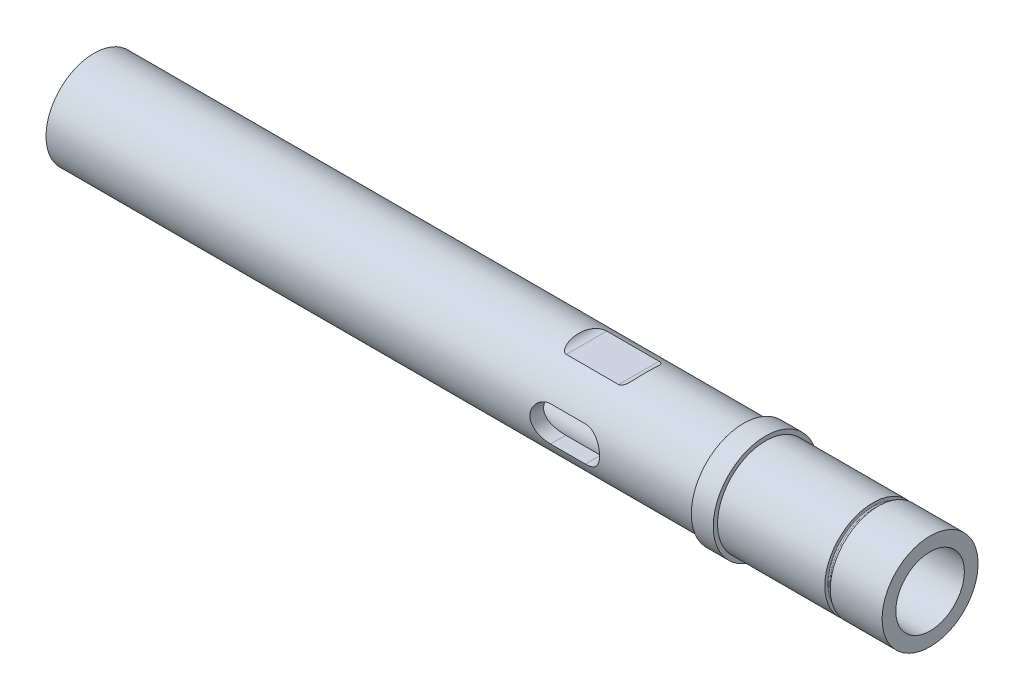
from build123d import *

# Parameters (mm, degrees)
SKETCH1_R               = 17.5
SKETCH1_R_2             = 12.5
BOSS_EXTRUDE1_DEPTH     = 152.4
SKETCH2_R               = 19.05
SKETCH2_R_2             = 17.5
BOSS_EXTRUDE2_DEPTH     = 8
SKETCH4_R               = 17.5
SKETCH4_R_2             = 16
CUT_EXTRUDE2_DEPTH      = 2
FILLET1_R               = 0.4064
CUT_EXTRUDE3_DEPTH      = 155.762931608
CUT_EXTRUDE3_DEPTH_BACK = 155.762931608
SKETCH8_W               = 25.4
SKETCH8_H               = 3.175
FILLET2_R               = 3.175
CUT_EXTRUDE4_REACH      = 156.763
CUT_EXTRUDE4_END_RADIUS = 17.5


with BuildPart() as part:
    # Sketch1 → Boss-Extrude1 (new, symmetric)
    with BuildSketch(Plane(origin=(0, 0, 0), x_dir=(0, 0, -1), z_dir=(1, 0, 0))):
        with Locations(Location((0, 0, 0), (0, 0, 180))):
            Circle(SKETCH1_R)
        with Locations(Location((0, 0, 0), (0, 0, 180))):
            Circle(SKETCH1_R_2, mode=Mode.SUBTRACT)
    extrude(amount=BOSS_EXTRUDE1_DEPTH, both=True)

    # Sketch2 → Boss-Extrude2 (add)
    with BuildSketch(Plane.ZY.offset(-92.4)):
        Circle(SKETCH2_R)
        Circle(SKETCH2_R_2, mode=Mode.SUBTRACT)
    extrude(amount=BOSS_EXTRUDE2_DEPTH)

    # Sketch4 → Cut-Extrude2 (cut)
    with BuildSketch(Plane(origin=(133.52, 0, 0), x_dir=(0, 0, -1), z_dir=(1, 0, 0))):
        with Locations(Location((0, 0, 0), (0, 0, 180))):
            Circle(SKETCH4_R)
        Circle(SKETCH4_R_2, mode=Mode.SUBTRACT)
    extrude(amount=-CUT_EXTRUDE2_DEPTH, mode=Mode.SUBTRACT)

    # Fillet1
    fillet1_edges = [part.edges().sort_by_distance(p)[0] for p in [
        (131.52, 0, 16),
        (133.52, 0, 16),
    ]]
    fillet(fillet1_edges, radius=FILLET1_R)

    # Sketch8 → Cut-Extrude3 (cut, two sides: drawn at the far end of the back side and taken through both)
    with BuildSketch(Plane.XY.offset(-CUT_EXTRUDE3_DEPTH_BACK)):
        with Locations((36.7, 17.4625)):
            Rectangle(SKETCH8_W, SKETCH8_H)
        with Locations((36.7, -17.4625)):
            Rectangle(SKETCH8_W, SKETCH8_H)
    extrude(amount=CUT_EXTRUDE3_DEPTH + CUT_EXTRUDE3_DEPTH_BACK, mode=Mode.SUBTRACT)

    # Fillet2
    # the kernel refuses this fillet: 3.175 mm, written as the material it adds along each edge
    with BuildSketch(Plane(origin=(49.4, -15.875, 15.301899161), x_dir=(-1, 0, 0), z_dir=(0, 0, -1))) as fillet2_piece_1_section:
        with BuildLine():
            CenterArc((FILLET2_R, -FILLET2_R), FILLET2_R, 90, 90)
            Line((0, -FILLET2_R), (0, 0))
            Line((0, 0), (FILLET2_R, 0))
        make_face()
    fillet2_piece_1 = extrude(amount=30.603798322, mode=Mode.PRIVATE)
    fillet2_piece_1 = fillet2_piece_1 & Plane(origin=(48.505622485, 0, 0), x_dir=(0, 0, 1), z_dir=(1, 0, 0)) * Cylinder(17.5, 74, mode=Mode.PRIVATE)
    add(fillet2_piece_1)
    with BuildSketch(Plane(origin=(24, -15.875, -15.301899161), x_dir=(1, 0, 0), z_dir=(0, 0, 1))) as fillet2_piece_2_section:
        with BuildLine():
            CenterArc((FILLET2_R, -FILLET2_R), FILLET2_R, 90, 90)
            Line((0, -FILLET2_R), (0, 0))
            Line((0, 0), (FILLET2_R, 0))
        make_face()
    fillet2_piece_2 = extrude(amount=30.603798322, mode=Mode.PRIVATE)
    fillet2_piece_2 = fillet2_piece_2 & Plane(origin=(24.894377515, 0, 0), x_dir=(0, 0, 1), z_dir=(1, 0, 0)) * Cylinder(17.5, 74, mode=Mode.PRIVATE)
    add(fillet2_piece_2)
    with BuildSketch(Plane(origin=(49.4, 15.875, 15.301899161), x_dir=(-1, 0, 0), z_dir=(0, 0, -1))) as fillet2_piece_3_section:
        with BuildLine():
            CenterArc((FILLET2_R, FILLET2_R), FILLET2_R, 180, 90)
            Line((0, FILLET2_R), (0, 0))
            Line((0, 0), (FILLET2_R, 0))
        make_face()
    fillet2_piece_3 = extrude(amount=30.603798322, mode=Mode.PRIVATE)
    fillet2_piece_3 = fillet2_piece_3 & Plane(origin=(48.50564536, 0, 0), x_dir=(0, 0, 1), z_dir=(1, 0, 0)) * Cylinder(17.5, 74, mode=Mode.PRIVATE)
    add(fillet2_piece_3)
    with BuildSketch(Plane(origin=(24, 15.875, -15.301899161), x_dir=(0, 1, 0), z_dir=(0, 0, 1))) as fillet2_piece_4_section:
        with BuildLine():
            CenterArc((FILLET2_R, -FILLET2_R), FILLET2_R, 90, 90)
            Line((0, -FILLET2_R), (0, 0))
            Line((0, 0), (FILLET2_R, 0))
        make_face()
    fillet2_piece_4 = extrude(amount=30.603798322, mode=Mode.PRIVATE)
    fillet2_piece_4 = fillet2_piece_4 & Plane(origin=(24.89438719, 0, 0), x_dir=(0, 0, 1), z_dir=(1, 0, 0)) * Cylinder(17.5, 74, mode=Mode.PRIVATE)
    add(fillet2_piece_4)

    # Cut-Extrude4: up to this cylinder (the profile starts inside it)
    cut_extrude4_end = Plane(origin=(36.7, 0, 0), z_dir=(-1, 0, 0)) * Cylinder(CUT_EXTRUDE4_END_RADIUS, 349.526, mode=Mode.PRIVATE)
    # Sketch9 → Cut-Extrude4 (cut, up to the surface)
    with BuildSketch(Plane.XY, mode=Mode.PRIVATE) as cut_extrude4_sk1:
        with BuildLine():
            Line((43.05, -6.35), (30.35, -6.35))
            ThreePointArc((30.35, -6.35), (24, 0), (30.35, 6.35))
            Line((30.35, 6.35), (43.05, 6.35))
            ThreePointArc((43.05, 6.35), (49.4, 0), (43.05, -6.35))
        make_face()
    cut_extrude4_tool1 = extrude(cut_extrude4_sk1.sketch, amount=CUT_EXTRUDE4_REACH, mode=Mode.PRIVATE) & cut_extrude4_end
    add(cut_extrude4_tool1.solids().sort_by_distance((36.7, 0, 0))[0], mode=Mode.SUBTRACT)


solid = part.part
